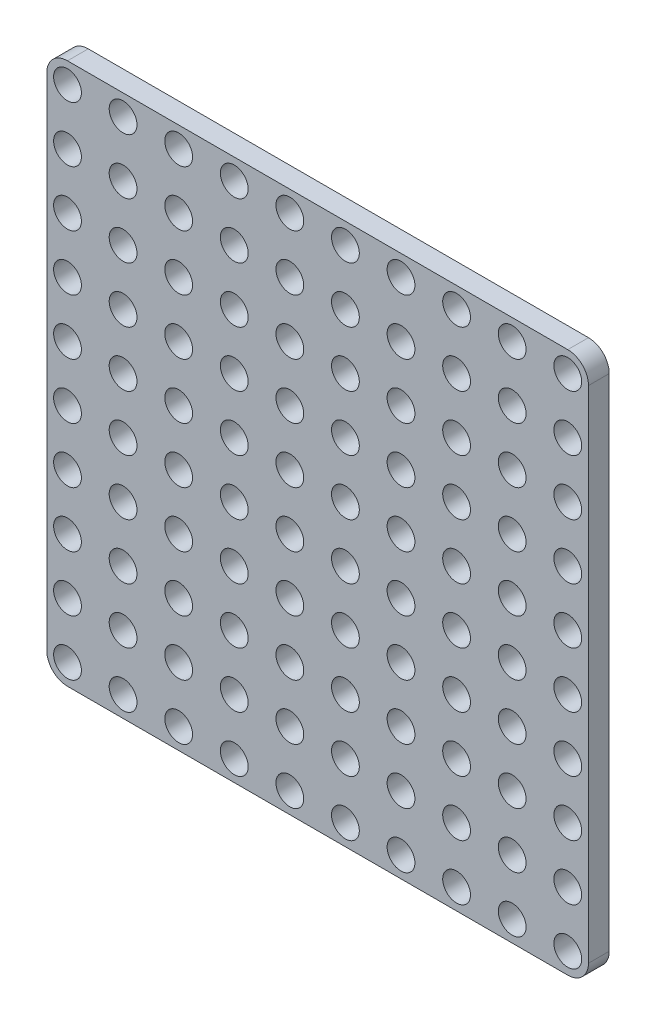
from build123d import *

# Parameters (mm, degrees)
SKIZZE1_W           = 130.6
SKIZZE1_H           = 130.6
SKIZZE1_R           = 3.35
BOSS_EXTRUDE1_DEPTH = 5
FILLET2_R           = 5


with BuildPart() as part:
    # Skizze1 → Boss-Extrude1 (new body)
    with BuildSketch(Plane.XY):
        with Locations((65.3, 65.3)):
            Rectangle(SKIZZE1_W, SKIZZE1_H)
        with Locations((5, 5)):
            Circle(SKIZZE1_R, mode=Mode.SUBTRACT)
        with Locations((5, 18.4)):
            Circle(SKIZZE1_R, mode=Mode.SUBTRACT)
        with Locations((5, 31.8)):
            Circle(SKIZZE1_R, mode=Mode.SUBTRACT)
        with Locations((5, 45.2)):
            Circle(SKIZZE1_R, mode=Mode.SUBTRACT)
        with Locations((5, 58.6)):
            Circle(SKIZZE1_R, mode=Mode.SUBTRACT)
        with Locations((5, 72)):
            Circle(SKIZZE1_R, mode=Mode.SUBTRACT)
        with Locations((5, 85.4)):
            Circle(SKIZZE1_R, mode=Mode.SUBTRACT)
        with Locations((5, 98.8)):
            Circle(SKIZZE1_R, mode=Mode.SUBTRACT)
        with Locations((5, 112.2)):
            Circle(SKIZZE1_R, mode=Mode.SUBTRACT)
        with Locations((5, 125.6)):
            Circle(SKIZZE1_R, mode=Mode.SUBTRACT)
        with Locations((18.4, 18.4)):
            Circle(SKIZZE1_R, mode=Mode.SUBTRACT)
        with Locations((18.4, 31.8)):
            Circle(SKIZZE1_R, mode=Mode.SUBTRACT)
        with Locations((18.4, 45.2)):
            Circle(SKIZZE1_R, mode=Mode.SUBTRACT)
        with Locations((18.4, 58.6)):
            Circle(SKIZZE1_R, mode=Mode.SUBTRACT)
        with Locations((18.4, 72)):
            Circle(SKIZZE1_R, mode=Mode.SUBTRACT)
        with Locations((18.4, 85.4)):
            Circle(SKIZZE1_R, mode=Mode.SUBTRACT)
        with Locations((18.4, 98.8)):
            Circle(SKIZZE1_R, mode=Mode.SUBTRACT)
        with Locations((18.4, 112.2)):
            Circle(SKIZZE1_R, mode=Mode.SUBTRACT)
        with Locations((18.4, 125.6)):
            Circle(SKIZZE1_R, mode=Mode.SUBTRACT)
        with Locations((31.8, 18.4)):
            Circle(SKIZZE1_R, mode=Mode.SUBTRACT)
        with Locations((31.8, 31.8)):
            Circle(SKIZZE1_R, mode=Mode.SUBTRACT)
        with Locations((31.8, 45.2)):
            Circle(SKIZZE1_R, mode=Mode.SUBTRACT)
        with Locations((31.8, 58.6)):
            Circle(SKIZZE1_R, mode=Mode.SUBTRACT)
        with Locations((31.8, 72)):
            Circle(SKIZZE1_R, mode=Mode.SUBTRACT)
        with Locations((31.8, 85.4)):
            Circle(SKIZZE1_R, mode=Mode.SUBTRACT)
        with Locations((31.8, 98.8)):
            Circle(SKIZZE1_R, mode=Mode.SUBTRACT)
        with Locations((31.8, 112.2)):
            Circle(SKIZZE1_R, mode=Mode.SUBTRACT)
        with Locations((31.8, 125.6)):
            Circle(SKIZZE1_R, mode=Mode.SUBTRACT)
        with Locations((45.2, 18.4)):
            Circle(SKIZZE1_R, mode=Mode.SUBTRACT)
        with Locations((45.2, 31.8)):
            Circle(SKIZZE1_R, mode=Mode.SUBTRACT)
        with Locations((45.2, 45.2)):
            Circle(SKIZZE1_R, mode=Mode.SUBTRACT)
        with Locations((45.2, 58.6)):
            Circle(SKIZZE1_R, mode=Mode.SUBTRACT)
        with Locations((45.2, 72)):
            Circle(SKIZZE1_R, mode=Mode.SUBTRACT)
        with Locations((45.2, 85.4)):
            Circle(SKIZZE1_R, mode=Mode.SUBTRACT)
        with Locations((45.2, 98.8)):
            Circle(SKIZZE1_R, mode=Mode.SUBTRACT)
        with Locations((45.2, 112.2)):
            Circle(SKIZZE1_R, mode=Mode.SUBTRACT)
        with Locations((45.2, 125.6)):
            Circle(SKIZZE1_R, mode=Mode.SUBTRACT)
        with Locations((58.6, 18.4)):
            Circle(SKIZZE1_R, mode=Mode.SUBTRACT)
        with Locations((58.6, 31.8)):
            Circle(SKIZZE1_R, mode=Mode.SUBTRACT)
        with Locations((58.6, 45.2)):
            Circle(SKIZZE1_R, mode=Mode.SUBTRACT)
        with Locations((58.6, 58.6)):
            Circle(SKIZZE1_R, mode=Mode.SUBTRACT)
        with Locations((58.6, 72)):
            Circle(SKIZZE1_R, mode=Mode.SUBTRACT)
        with Locations((58.6, 85.4)):
            Circle(SKIZZE1_R, mode=Mode.SUBTRACT)
        with Locations((58.6, 98.8)):
            Circle(SKIZZE1_R, mode=Mode.SUBTRACT)
        with Locations((58.6, 112.2)):
            Circle(SKIZZE1_R, mode=Mode.SUBTRACT)
        with Locations((58.6, 125.6)):
            Circle(SKIZZE1_R, mode=Mode.SUBTRACT)
        with Locations((72, 18.4)):
            Circle(SKIZZE1_R, mode=Mode.SUBTRACT)
        with Locations((72, 31.8)):
            Circle(SKIZZE1_R, mode=Mode.SUBTRACT)
        with Locations((72, 45.2)):
            Circle(SKIZZE1_R, mode=Mode.SUBTRACT)
        with Locations((72, 58.6)):
            Circle(SKIZZE1_R, mode=Mode.SUBTRACT)
        with Locations((72, 72)):
            Circle(SKIZZE1_R, mode=Mode.SUBTRACT)
        with Locations((72, 85.4)):
            Circle(SKIZZE1_R, mode=Mode.SUBTRACT)
        with Locations((72, 98.8)):
            Circle(SKIZZE1_R, mode=Mode.SUBTRACT)
        with Locations((72, 112.2)):
            Circle(SKIZZE1_R, mode=Mode.SUBTRACT)
        with Locations((72, 125.6)):
            Circle(SKIZZE1_R, mode=Mode.SUBTRACT)
        with Locations((85.4, 18.4)):
            Circle(SKIZZE1_R, mode=Mode.SUBTRACT)
        with Locations((85.4, 31.8)):
            Circle(SKIZZE1_R, mode=Mode.SUBTRACT)
        with Locations((85.4, 45.2)):
            Circle(SKIZZE1_R, mode=Mode.SUBTRACT)
        with Locations((85.4, 58.6)):
            Circle(SKIZZE1_R, mode=Mode.SUBTRACT)
        with Locations((85.4, 72)):
            Circle(SKIZZE1_R, mode=Mode.SUBTRACT)
        with Locations((85.4, 85.4)):
            Circle(SKIZZE1_R, mode=Mode.SUBTRACT)
        with Locations((85.4, 98.8)):
            Circle(SKIZZE1_R, mode=Mode.SUBTRACT)
        with Locations((85.4, 112.2)):
            Circle(SKIZZE1_R, mode=Mode.SUBTRACT)
        with Locations((85.4, 125.6)):
            Circle(SKIZZE1_R, mode=Mode.SUBTRACT)
        with Locations((98.8, 18.4)):
            Circle(SKIZZE1_R, mode=Mode.SUBTRACT)
        with Locations((98.8, 31.8)):
            Circle(SKIZZE1_R, mode=Mode.SUBTRACT)
        with Locations((98.8, 45.2)):
            Circle(SKIZZE1_R, mode=Mode.SUBTRACT)
        with Locations((98.8, 58.6)):
            Circle(SKIZZE1_R, mode=Mode.SUBTRACT)
        with Locations((98.8, 72)):
            Circle(SKIZZE1_R, mode=Mode.SUBTRACT)
        with Locations((98.8, 85.4)):
            Circle(SKIZZE1_R, mode=Mode.SUBTRACT)
        with Locations((98.8, 98.8)):
            Circle(SKIZZE1_R, mode=Mode.SUBTRACT)
        with Locations((98.8, 112.2)):
            Circle(SKIZZE1_R, mode=Mode.SUBTRACT)
        with Locations((98.8, 125.6)):
            Circle(SKIZZE1_R, mode=Mode.SUBTRACT)
        with Locations((112.2, 18.4)):
            Circle(SKIZZE1_R, mode=Mode.SUBTRACT)
        with Locations((112.2, 31.8)):
            Circle(SKIZZE1_R, mode=Mode.SUBTRACT)
        with Locations((112.2, 45.2)):
            Circle(SKIZZE1_R, mode=Mode.SUBTRACT)
        with Locations((112.2, 58.6)):
            Circle(SKIZZE1_R, mode=Mode.SUBTRACT)
        with Locations((112.2, 72)):
            Circle(SKIZZE1_R, mode=Mode.SUBTRACT)
        with Locations((112.2, 85.4)):
            Circle(SKIZZE1_R, mode=Mode.SUBTRACT)
        with Locations((112.2, 98.8)):
            Circle(SKIZZE1_R, mode=Mode.SUBTRACT)
        with Locations((112.2, 112.2)):
            Circle(SKIZZE1_R, mode=Mode.SUBTRACT)
        with Locations((112.2, 125.6)):
            Circle(SKIZZE1_R, mode=Mode.SUBTRACT)
        with Locations((125.6, 18.4)):
            Circle(SKIZZE1_R, mode=Mode.SUBTRACT)
        with Locations((125.6, 31.8)):
            Circle(SKIZZE1_R, mode=Mode.SUBTRACT)
        with Locations((125.6, 45.2)):
            Circle(SKIZZE1_R, mode=Mode.SUBTRACT)
        with Locations((125.6, 58.6)):
            Circle(SKIZZE1_R, mode=Mode.SUBTRACT)
        with Locations((125.6, 72)):
            Circle(SKIZZE1_R, mode=Mode.SUBTRACT)
        with Locations((125.6, 85.4)):
            Circle(SKIZZE1_R, mode=Mode.SUBTRACT)
        with Locations((125.6, 98.8)):
            Circle(SKIZZE1_R, mode=Mode.SUBTRACT)
        with Locations((125.6, 112.2)):
            Circle(SKIZZE1_R, mode=Mode.SUBTRACT)
        with Locations((125.6, 125.6)):
            Circle(SKIZZE1_R, mode=Mode.SUBTRACT)
        with Locations((18.4, 5)):
            Circle(SKIZZE1_R, mode=Mode.SUBTRACT)
        with Locations((31.8, 5)):
            Circle(SKIZZE1_R, mode=Mode.SUBTRACT)
        with Locations((45.2, 5)):
            Circle(SKIZZE1_R, mode=Mode.SUBTRACT)
        with Locations((58.6, 5)):
            Circle(SKIZZE1_R, mode=Mode.SUBTRACT)
        with Locations((72, 5)):
            Circle(SKIZZE1_R, mode=Mode.SUBTRACT)
        with Locations((85.4, 5)):
            Circle(SKIZZE1_R, mode=Mode.SUBTRACT)
        with Locations((98.8, 5)):
            Circle(SKIZZE1_R, mode=Mode.SUBTRACT)
        with Locations((112.2, 5)):
            Circle(SKIZZE1_R, mode=Mode.SUBTRACT)
        with Locations((125.6, 5)):
            Circle(SKIZZE1_R, mode=Mode.SUBTRACT)
    extrude(amount=BOSS_EXTRUDE1_DEPTH)

    # Fillet2
    fillet2_edges = [part.edges().sort_by_distance(p)[0] for p in [
        (0, 0, 2.5),
        (0, 130.6, 2.5),
        (130.6, 130.6, 2.5),
        (130.6, 0, 2.5),
    ]]
    fillet(fillet2_edges, radius=FILLET2_R)


solid = part.part
